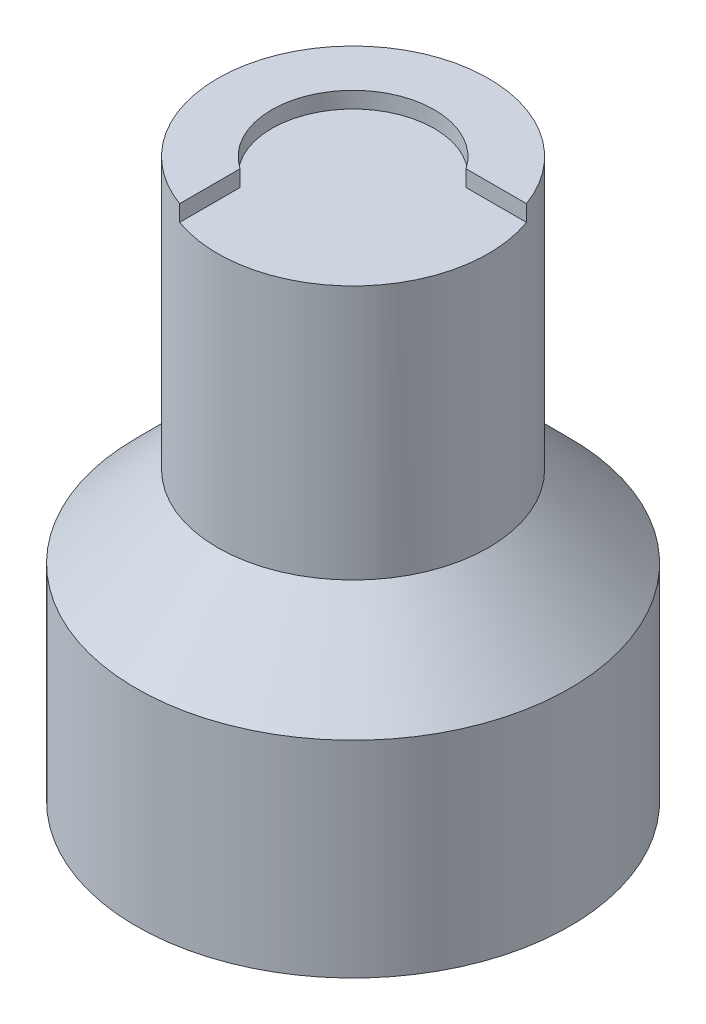
from build123d import *

# Parameters (mm, degrees)
CUT_EXTRUDE_871_DEPTH  = 0.6
CHAMFER_1_SIZE         = 3
SKETCH_5_R             = 5.1
CUT_EXTRUDE_1040_DEPTH = 5.1
HOLE_WIZARD_M3_D       = 2.5
HOLE_WIZARD_M3_DEPTH   = 10
HOLE_WIZARD_M3_TIP     = 0.751075774


with BuildPart() as part:
    # Эскиз1 → Revolve 522 (revolve)
    with BuildSketch(Plane.XY):
        Polygon((0, 10.3), (-5, 10.3), (-5, 0.3), (-8, 0.3), (-8, -10.3), (0, -10.3), align=None)
    revolve(axis=Axis((0, 10.3, 0), (0, -1, 0)))

    # Эскиз4 → Cut-Extrude 871 (cut)
    with BuildSketch(Plane(origin=(0, 10.3, 0), x_dir=(1, 0, 0), z_dir=(0, 1, 0))):
        with BuildLine():
            Line((2.474108329, 1.696699141), (5.303300859, 1.696699141))
            Line((5.303300859, 1.696699141), (5.303300859, -5.303300859))
            Line((5.303300859, -5.303300859), (-1.696699141, -5.303300859))
            Line((-1.696699141, -5.303300859), (-1.696699141, -2.474108329))
            ThreePointArc((-1.696699141, -2.474108329), (-2.121320344, 2.121320344), (2.474108329, 1.696699141))
        make_face()
    extrude(amount=-CUT_EXTRUDE_871_DEPTH, mode=Mode.SUBTRACT)

    # Фаска1
    chamfer_1_edges = [part.edges().sort_by_distance(p)[0] for p in [
        (8, 0.3, 0),
    ]]
    chamfer(chamfer_1_edges, length=CHAMFER_1_SIZE - 0.0001)  # a hair under: the kernel refuses the full size

    # Эскиз5 → Cut-Extrude 1040 (cut)
    with BuildSketch(Plane.XZ.offset(10.3)):
        Circle(SKETCH_5_R)
    extrude(amount=-CUT_EXTRUDE_1040_DEPTH, mode=Mode.SUBTRACT)

    # Крепление магнита M3
    with Locations(Plane(origin=(0, -5.2, 0), x_dir=(-1, 0, 0), z_dir=(0, -1, 0))):
        with Locations((0, 0)):
            Hole(HOLE_WIZARD_M3_D / 2, depth=HOLE_WIZARD_M3_DEPTH)
            with Locations((0, 0, -(HOLE_WIZARD_M3_DEPTH + HOLE_WIZARD_M3_TIP / 2))):  # 118° drill point
                Cone(0, HOLE_WIZARD_M3_D / 2, HOLE_WIZARD_M3_TIP, mode=Mode.SUBTRACT)


solid = part.part
